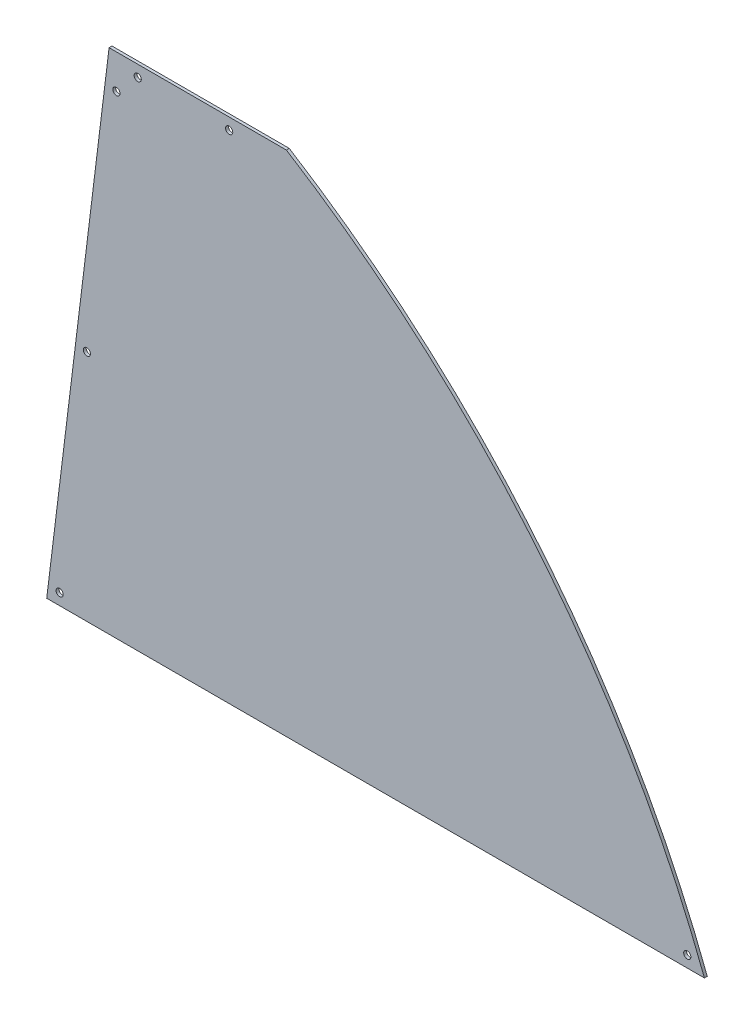
from build123d import *

# Parameters (mm, degrees)
BOSS_EXTRUDE1_DEPTH            = 3.175
F_5_16_0_3125_DIAMETER_HOLE1_D = 7.9375


with BuildPart() as part:
    # Sketch2 → Boss-Extrude1 (new body)
    with BuildSketch(Plane.XY):
        with BuildLine():
            Line((-205.693605409, 145.623791632), (-8.843605409, 145.623791632))
            ThreePointArc((-8.843605409, 145.623791632), (269.502650215, -98.34340657), (455.295, -418.465))
            Line((455.295, -418.465), (-274.955, -418.465))
            Line((-274.955, -418.465), (-205.693605409, 145.623791632))
        make_face()
    extrude(amount=BOSS_EXTRUDE1_DEPTH)

    # 5/16 (0.3125) Diameter Hole1 (through all)
    with Locations(Plane(origin=(0, 0, 0), x_dir=(-1, 0, 0), z_dir=(0, 0, -1))):
        with Locations((-436.245, -405.765), (260.600261293, -405.765), (230.322964789, -159.176208368), (197.576322396, 107.523791632), (173.943605409, 132.923791632), (72.343605409, 132.923791632)):
            Hole(F_5_16_0_3125_DIAMETER_HOLE1_D / 2)


solid = part.part
